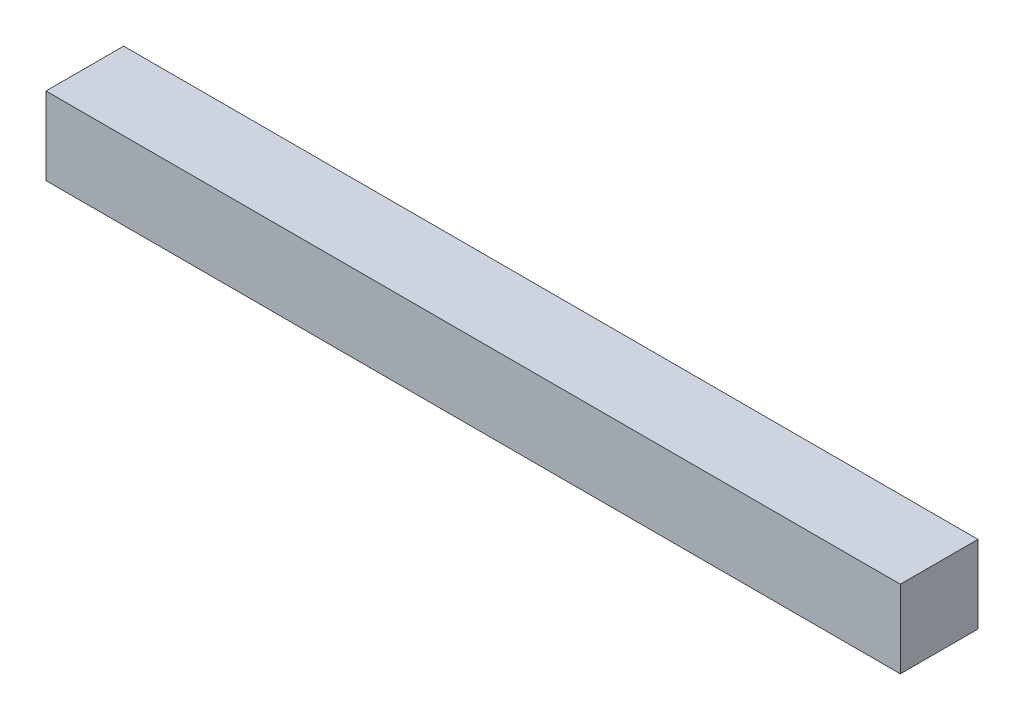
from build123d import *

# Parameters (mm, degrees)
SKETCH_1_W      = 110
SKETCH_1_H      = 10
EXTRUDE_1_DEPTH = 10


with BuildPart() as part:
    # ｽｹｯﾁ1 → ﾎﾞｽ - 押し出し1 (new body)
    with BuildSketch(Plane(origin=(0, 0, 0), x_dir=(1, 0, 0), z_dir=(0, 1, 0))):
        Rectangle(SKETCH_1_W, SKETCH_1_H)
    extrude(amount=EXTRUDE_1_DEPTH)


solid = part.part
